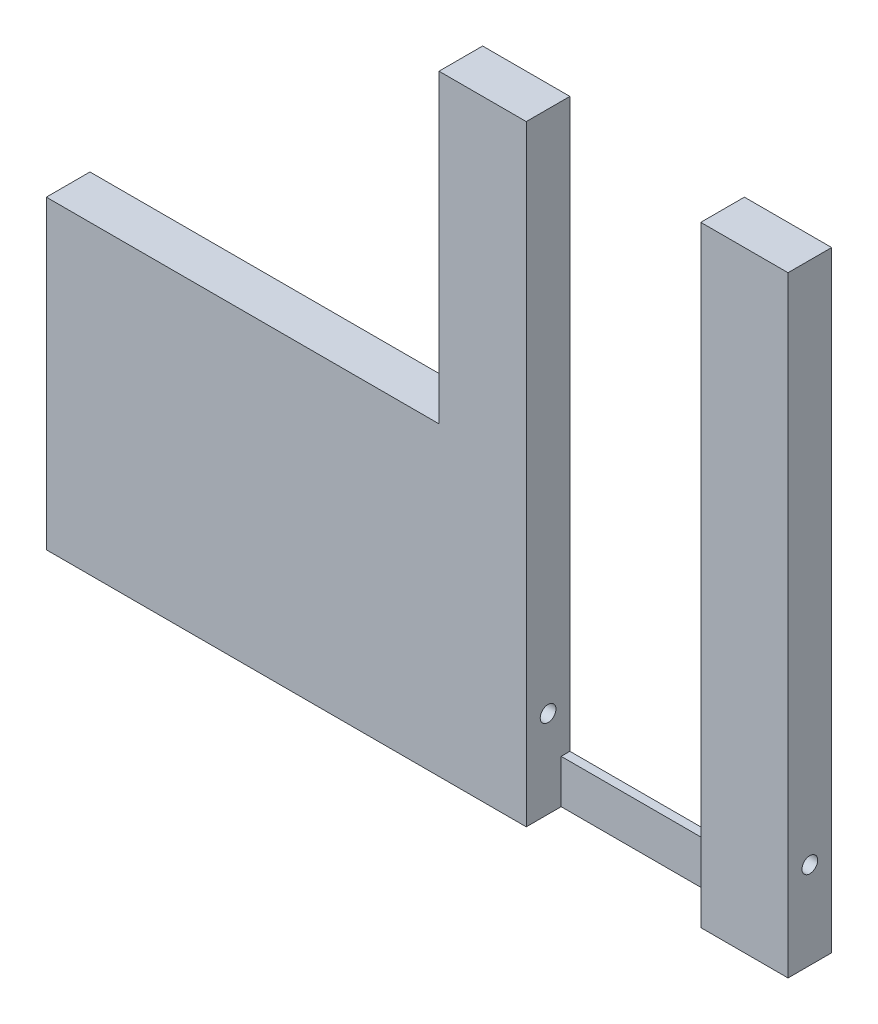
from build123d import *

# Parameters (mm, degrees)
SKETCH2_W             = 4
SKETCH2_H             = 28
BOSS_EXTRUDE1_DEPTH   = 2
BOSS_EXTRUDE1_2_DEPTH = 2
SKETCH3_W             = 16
SKETCH3_H             = 2
BOSS_EXTRUDE2_DEPTH   = 0.4
SKETCH7_W             = 2
SKETCH7_H             = 14
BOSS_EXTRUDE3_DEPTH   = 18
SKETCH6_R             = 0.36
CUT_EXTRUDE1_DEPTH    = 45.09081537


with BuildPart() as part:
    # Sketch2 → Boss-Extrude1 (new body)
    with BuildSketch(Plane.XY):
        with Locations((2, 14)):
            Rectangle(SKETCH2_W, SKETCH2_H)
    extrude(amount=BOSS_EXTRUDE1_DEPTH)



with BuildPart() as body_2:
    # Sketch2 → Boss-Extrude1 2 (new body)
    with BuildSketch(Plane.XY):
        with Locations((14, 14)):
            Rectangle(SKETCH2_W, SKETCH2_H)
    extrude(amount=BOSS_EXTRUDE1_2_DEPTH)


with BuildPart() as part_1:
    add(part.part)

    add(body_2.part)  # Boss-Extrude2 merges body 2
    # Sketch3 → Boss-Extrude2 (add)
    with BuildSketch(Plane(origin=(0, 0, 0), x_dir=(-1, 0, 0), z_dir=(0, 0, -1))):
        with Locations((-8, 1)):
            Rectangle(SKETCH3_W, SKETCH3_H)
    extrude(amount=-BOSS_EXTRUDE2_DEPTH)

    # Sketch7 → Boss-Extrude3 (add)
    with BuildSketch(Plane.ZY):
        with Locations((1, 7)):
            Rectangle(SKETCH7_W, SKETCH7_H)
    extrude(amount=BOSS_EXTRUDE3_DEPTH)

    # Sketch6 → Cut-Extrude1 (cut, through all)
    with BuildSketch(Plane(origin=(16, 0, 0), x_dir=(0, 0, -1), z_dir=(1, 0, 0))):
        with Locations((-1, 4)):
            Circle(SKETCH6_R)
    extrude(amount=-CUT_EXTRUDE1_DEPTH, mode=Mode.SUBTRACT)


solid = part_1.part
